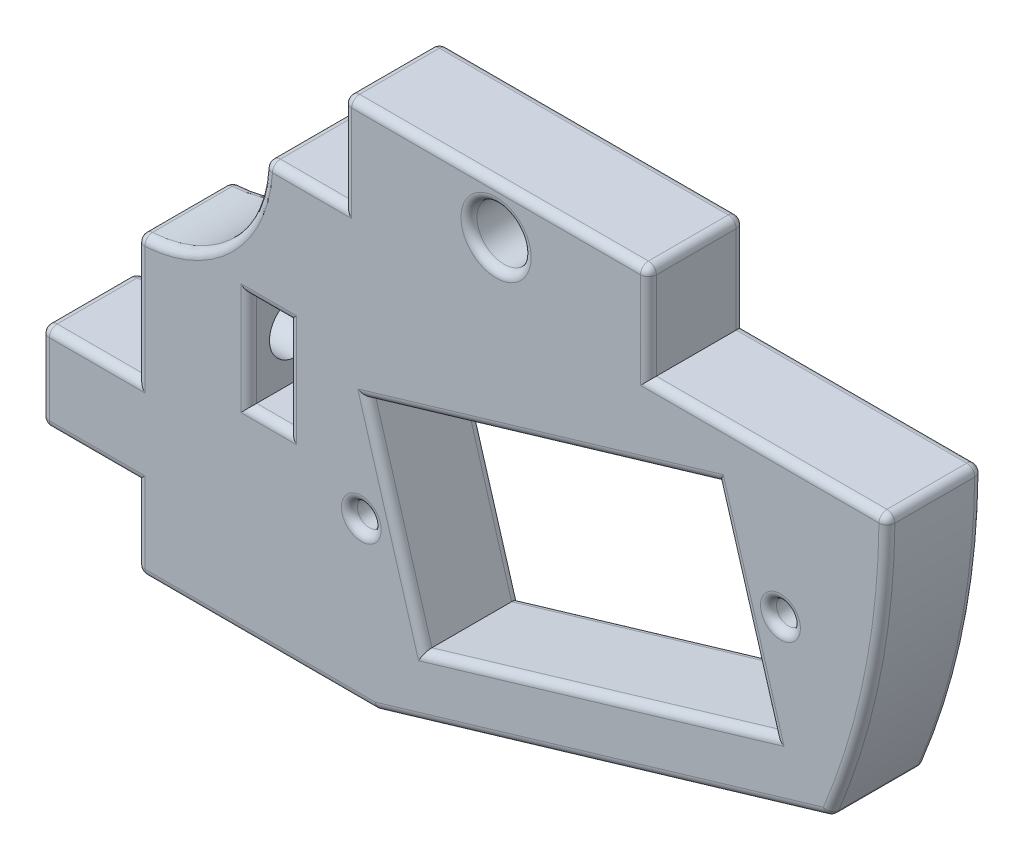
from build123d import *

# Parameters (mm, degrees)
BODY_DEPTH                = 6
SKETCH2_W                 = 19.1
SKETCH2_H                 = 6
TOP_TAB_DEPTH             = 6
SKETCH3_W                 = 6
SKETCH3_H                 = 5.5
BACK_TAB_DEPTH            = 6
SKETCH5_R                 = 1.7
BACK_SCREW_HOLE_DEPTH     = 12
SCREW_AND_NUT_HOLES_REACH = 56.289
SKETCH4_R                 = 1.7
SKETCH4_W                 = 2.5
SKETCH4_H                 = 6
SKETCH7_R                 = 8
SWITCH_WIRE_RELIEF_DEPTH  = 55.288580751
ROUNDED_START             = -6
ROUNDED_CORNER_OUTLINE_R  = 0.75
ROUNDED_CORNER_DEPTH      = 6
FILLET1_R                 = 0.5


# Read off the part's stored shape, not the designer's step: Rounded Corner
with BuildPart() as part:
    # Sketch1 → Body (new body)
    with BuildSketch(Plane.XY):
        Polygon((0, -26.5), (15, -26.5), (47, -17), (47, 0), (0, 0), align=None)
    extrude(amount=-BODY_DEPTH)

    # Sketch2 → Top Tab (add)
    with BuildSketch(Plane(origin=(0, 0, 0), x_dir=(1, 0, 0), z_dir=(0, 1, 0))):
        with Locations((22.5, 3)):
            Rectangle(SKETCH2_W, SKETCH2_H)
    extrude(amount=TOP_TAB_DEPTH)

    # Sketch3 → Back Tab (add)
    with BuildSketch(Plane.ZY):
        with Locations((-3, -18.69)):
            Rectangle(SKETCH3_W, SKETCH3_H)
    extrude(amount=BACK_TAB_DEPTH)

    # Sketch5 → Back Screw Hole (cut)
    with BuildSketch(Plane.ZY):
        with Locations(Location((-3, -11, 0), (0, 0, 270))):
            Circle(SKETCH5_R)
    extrude(amount=-BACK_SCREW_HOLE_DEPTH, mode=Mode.SUBTRACT)

    # Sketch4 → Screw and Nut Holes (cut, up to next)
    with BuildSketch(Plane.XY, mode=Mode.PRIVATE) as screw_and_nut_holes_sk1:
        with Locations((22.5, 3)):
            Circle(SKETCH4_R)
    screw_and_nut_holes_tool1 = extrude(screw_and_nut_holes_sk1.sketch, amount=-SCREW_AND_NUT_HOLES_REACH, mode=Mode.PRIVATE) & part.part
    # Sketch4 → Screw and Nut Holes (cut, up to next)
    with BuildSketch(Plane.XY, mode=Mode.PRIVATE) as screw_and_nut_holes_sk2:
        with Locations((8.25, -11)):
            Rectangle(SKETCH4_W, SKETCH4_H)
    screw_and_nut_holes_tool2 = extrude(screw_and_nut_holes_sk2.sketch, amount=-SCREW_AND_NUT_HOLES_REACH, mode=Mode.PRIVATE) & part.part
    add(screw_and_nut_holes_tool1.solids().sort_by_distance((22.5, 3, 0))[0], mode=Mode.SUBTRACT)
    add(screw_and_nut_holes_tool2.solids().sort_by_distance((8.25, -11, 0))[0], mode=Mode.SUBTRACT)

    # Sketch7 → Switch Wire Relief (cut, through all)
    with BuildSketch(Plane.XY):
        Circle(SKETCH7_R)
    extrude(amount=-SWITCH_WIRE_RELIEF_DEPTH, mode=Mode.SUBTRACT)

    # Rounded Corner outline → Rounded Corner (cut)
    with BuildSketch(Plane.XY.offset(ROUNDED_START)):
        Polygon((39.930752628, -15.259504453), (36.401733852, -3.372283311), (14.448720614, -9.889584116), (17.97773939, -21.776805258), align=None)
        with Locations((14.056274553, -16.473540836)):
            Circle(ROUNDED_CORNER_OUTLINE_R)
        with Locations((40.323198689, -8.675547733)):
            Circle(ROUNDED_CORNER_OUTLINE_R)
        with BuildLine():
            ThreePointArc((47, 0), (46.087728798, -9.215272882), (43.386329605, -18.072808399))
            Line((43.386329605, -18.072808399), (47, -17))
            Line((47, -17), (47, 0))
        make_face()
    extrude(amount=ROUNDED_CORNER_DEPTH, mode=Mode.SUBTRACT)

    # Fillet1
    fillet1_edges = [part.edges().sort_by_distance(p)[0] for p in [
        (39.525, 0, -6),
        (32.05, 3, -6),
        (22.5, 6, -6),
        (12.95, 3, -6),
        (10.475, 0, -6),
        (5.656854249, -5.656854249, -6),
        (0, -11.97, -6),
        (-3, -15.94, -6),
        (-6, -18.69, -6),
        (-3, -21.44, -6),
        (0, -23.97, -6),
        (7.5, -26.5, -6),
        (29.193164802, -22.286404199, -6),
        (39.573198689, -8.675547733, -6),
        (13.306274553, -16.473540836, -6),
        (28.954246009, -18.518154856, -6),
        (16.213230002, -15.833194687, -6),
        (25.425227233, -6.630933713, -6),
        (38.16624324, -9.315893882, -6),
        (9.5, -11, -6),
        (8.25, -14, -6),
        (7, -11, -6),
        (8.25, -8, -6),
        (20.8, 3, -6),
        (7.5, -26.5, 0),
        (0, -23.97, 0),
        (-3, -21.44, 0),
        (-6, -18.69, 0),
        (-3, -15.94, 0),
        (0, -11.97, 0),
        (5.656854249, -5.656854249, 0),
        (10.475, 0, 0),
        (12.95, 3, 0),
        (22.5, 6, 0),
        (32.05, 3, 0),
        (39.525, 0, 0),
        (29.193164802, -22.286404199, 0),
        (39.573198689, -8.675547733, 0),
        (13.306274553, -16.473540836, 0),
        (16.213230002, -15.833194687, 0),
        (28.954246009, -18.518154856, 0),
        (38.16624324, -9.315893882, 0),
        (25.425227233, -6.630933713, 0),
        (8.25, -14, 0),
        (9.5, -11, 0),
        (8.25, -8, 0),
        (7, -11, 0),
        (20.8, 3, 0),
        (15, -26.5, -3),
        (0, -26.5, -3),
        (-6, -21.44, -3),
        (-6, -15.94, -3),
        (0, -8, -3),
        (8, 0, -3),
        (12.95, 6, -3),
        (32.05, 6, -3),
        (46.087728798, -9.215272882, -6),
        (46.087728798, -9.215272882, 0),
        (43.386329605, -18.072808399, -3),
        (47, 0, -3),
    ]]
    fillet(fillet1_edges, radius=FILLET1_R)


solid = part.part
